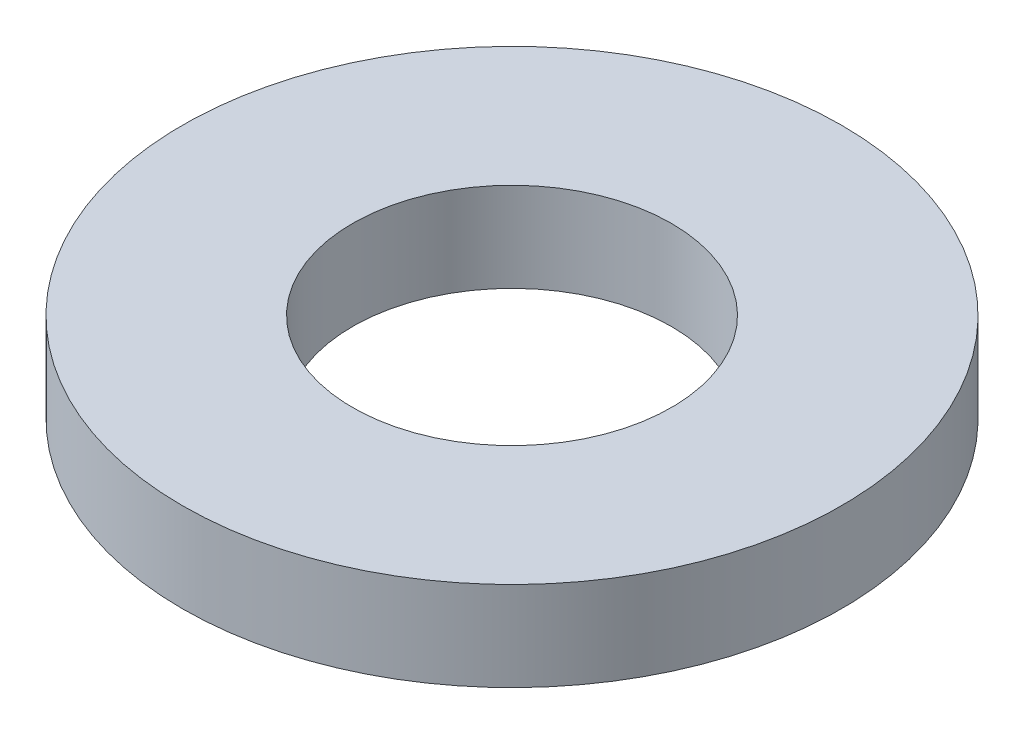
from build123d import *

# Parameters (mm, degrees)
SKETCH1_R           = 77.5
BOSS_EXTRUDE1_DEPTH = 21
SKETCH2_R           = 37.5
CUT_EXTRUDE1_DEPTH  = 112.595250795


with BuildPart() as part:
    # Sketch1 → Boss-Extrude1 (new body)
    with BuildSketch(Plane(origin=(0, 0, 0), x_dir=(1, 0, 0), z_dir=(0, 1, 0))):
        Circle(SKETCH1_R)
    extrude(amount=BOSS_EXTRUDE1_DEPTH)

    # Sketch2 → Cut-Extrude1 (cut, through all)
    with BuildSketch(Plane(origin=(0, 0, 0), x_dir=(1, 0, 0), z_dir=(0, 1, 0))):
        Circle(SKETCH2_R)
    extrude(amount=CUT_EXTRUDE1_DEPTH, mode=Mode.SUBTRACT)


solid = part.part
